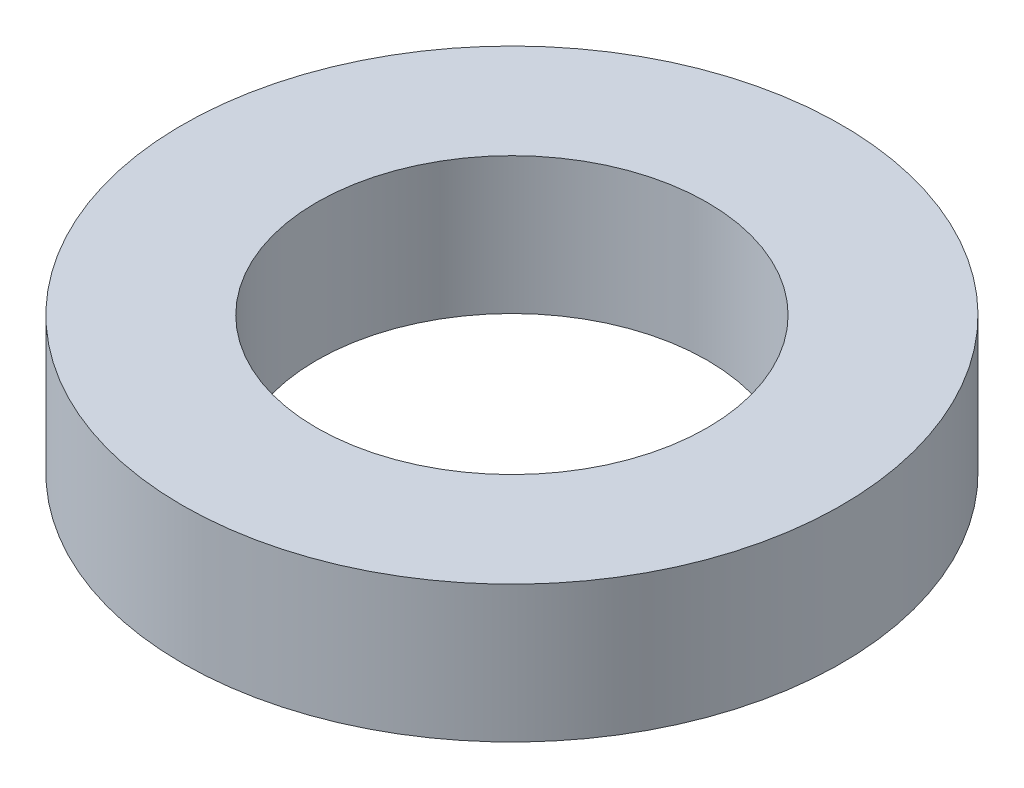
from build123d import *

# Parameters (mm, degrees)
SKETCH1_R           = 67.5
BOSS_EXTRUDE1_DEPTH = 28
SKETCH2_R           = 40
CUT_EXTRUDE1_DEPTH  = 100.481153994


with BuildPart() as part:
    # Sketch1 → Boss-Extrude1 (new body)
    with BuildSketch(Plane(origin=(0, 0, 0), x_dir=(1, 0, 0), z_dir=(0, 1, 0))):
        Circle(SKETCH1_R)
    extrude(amount=BOSS_EXTRUDE1_DEPTH)

    # Sketch2 → Cut-Extrude1 (cut, through all)
    with BuildSketch(Plane(origin=(0, 0, 0), x_dir=(1, 0, 0), z_dir=(0, 1, 0))):
        Circle(SKETCH2_R)
    extrude(amount=CUT_EXTRUDE1_DEPTH, mode=Mode.SUBTRACT)


solid = part.part
